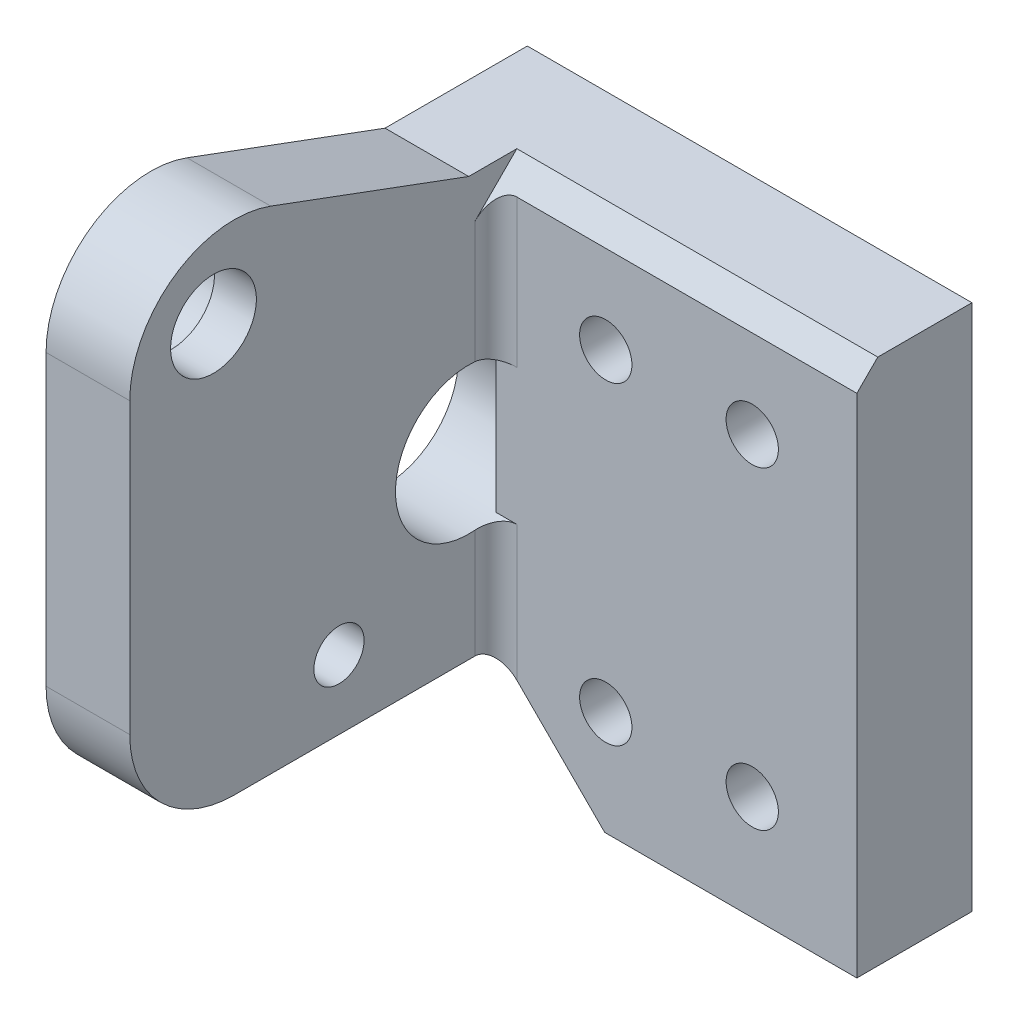
from build123d import *

# Parameters (mm, degrees)
SKETCH_1_W             = 69.5
SKETCH_1_H             = 24
EXTRUDE_1_DEPTH        = 10.5
SKETCH_2_W             = 35
SKETCH_2_H             = 3
CUT_EXTRUDE_2_DEPTH    = 24
HOLE_WIZARD_M3_1_D     = 2.5
HOLE_WIZARD_M3_1_DEPTH = 7.5
HOLE_WIZARD_M3_1_TIP   = 0.751075774
CHAMFER_1_SIZE         = 0.5
CHAMFER_2_SIZE         = 0.5
CHAMFER_3_SIZE         = 5.2
FILLET1_R              = 2
SKETCH_8_W             = 10.5
SKETCH_8_H             = 1.2
EXTRUDE_1_2_DEPTH      = 69.5
SKETCH_7_W             = 35
SKETCH_7_H             = 30
CUT_EXTRUDE_1_DEPTH    = 71.5
FILLET_1_R             = 2
FILLET_2_R             = 2
SKETCH2_W              = 16.266114445
SKETCH2_H              = 35.800653755
SKETCH2_W_2            = 16.722173729
SKETCH2_H_2            = 38.308979815
EXTRUDE1_DEPTH         = 5
SKETCH4_R              = 2.05
SKETCH4_R_2            = 3.5
EXTRUDE2_DEPTH         = 4
FILLET2_R              = 5
SKETCH7_R              = 3.5
SKETCH7_R_2            = 2.05
EXTRUDE3_DEPTH         = 4
FILLET3_R              = 5
FILLET5_R              = 1
SKETCH14_R             = 2.4
EXTRUDE4_DEPTH         = 2
SKETCH15_R             = 2.4
EXTRUDE5_DEPTH         = 2
SKETCH_9_W             = 36.650882696
SKETCH_9_H             = 47.613245362
CUT_EXTRUDE_2_2_DEPTH  = 49.168282868
SKETCH_10_W            = 16.727542875
SKETCH_10_H            = 39.365484233
CUT_EXTRUDE_3_DEPTH    = 5
CHAMFER_8_SIZE         = 1
FILLET_4_R             = 1


with BuildPart() as part:
    # 草图1 → Extrude 1 (new body)
    with BuildSketch(Plane.XY):
        Rectangle(SKETCH_1_W, SKETCH_1_H)
    extrude(amount=EXTRUDE_1_DEPTH)

    # 草图2 → Cut-Extrude 2 (cut)
    with BuildSketch(Plane.XZ.offset(12)):
        with Locations((0, 1.5)):
            Rectangle(SKETCH_2_W, SKETCH_2_H)
    extrude(amount=-CUT_EXTRUDE_2_DEPTH, mode=Mode.SUBTRACT)

    # M3 螺纹孔1
    with Locations(Plane(origin=(22.5, 8, 0), x_dir=(-1, 0, 0), z_dir=(0, 0, -1))):
        with Locations((0, 0), (0, -15), (45, -15), (45, 0), (-7, 0), (-7, -15), (52, -15), (52, 0)):
            Hole(HOLE_WIZARD_M3_1_D / 2, depth=HOLE_WIZARD_M3_1_DEPTH)
            with Locations((0, 0, -(HOLE_WIZARD_M3_1_DEPTH + HOLE_WIZARD_M3_1_TIP / 2))):  # 118° drill point
                Cone(0, HOLE_WIZARD_M3_1_D / 2, HOLE_WIZARD_M3_1_TIP, mode=Mode.SUBTRACT)

    # 倒角1
    chamfer_1_edges = [part.edges().sort_by_distance(p)[0] for p in [
        (-23.75, 8, 0),
        (-23.75, -7, 0),
        (21.25, -7, 0),
        (21.25, 8, 0),
    ]]
    chamfer(chamfer_1_edges, length=CHAMFER_1_SIZE)

    # 倒角2
    chamfer_2_edges = [part.edges().sort_by_distance(p)[0] for p in [
        (-30.75, 8, 0),
        (-30.75, -7, 0),
        (28.25, -7, 0),
        (28.25, 8, 0),
    ]]
    chamfer(chamfer_2_edges, length=CHAMFER_2_SIZE)

    # 倒角3
    chamfer_3_edges = [part.edges().sort_by_distance(p)[0] for p in [
        (34.75, -12, 5.25),
        (-34.75, -12, 5.25),
    ]]
    chamfer(chamfer_3_edges, length=CHAMFER_3_SIZE)

    # Fillet1
    fillet1_edges = [part.edges().sort_by_distance(p)[0] for p in [
        (0, -12, 10.5),
    ]]
    fillet(fillet1_edges, radius=FILLET1_R)

    # 草图8 → Extrude 1 2 (add)
    with BuildSketch(Plane(origin=(34.75, 0, 0), x_dir=(0, 0, -1), z_dir=(1, 0, 0))):
        with Locations((-5.25, 12.6)):
            Rectangle(SKETCH_8_W, SKETCH_8_H)
    extrude(amount=-EXTRUDE_1_2_DEPTH)

    # 草图7 → 切除-拉伸1 (cut)
    with BuildSketch(Plane.XY.offset(10.5)):
        with Locations((0, 3)):
            Rectangle(SKETCH_7_W, SKETCH_7_H)
    extrude(amount=-CUT_EXTRUDE_1_DEPTH, mode=Mode.SUBTRACT)


with BuildPart() as cut_extrude_1_piece_1:
    # of the separate pieces the step leaves, piece 1, a body of its own (cut_extrude_1_pieces)
    add(part.part.solids().sort_by_distance((29.55, -12, 8.5))[0])

    # 圆角1
    fillet_1_edges = [cut_extrude_1_piece_1.edges().sort_by_distance(p)[0] for p in [
        (26.125, 13.2, 10.5),
    ]]
    fillet(fillet_1_edges, radius=FILLET_1_R)


with BuildPart() as cut_extrude_1_piece_2:
    # of the separate pieces the step leaves, piece 2, a body of its own (cut_extrude_1_pieces)
    add(part.part.solids().sort_by_distance((-29.55, -12, 8.5))[0])

    # 圆角2
    fillet_2_edges = [cut_extrude_1_piece_2.edges().sort_by_distance(p)[0] for p in [
        (-26.125, 13.2, 10.5),
    ]]
    fillet(fillet_2_edges, radius=FILLET_2_R)


with BuildPart() as extrude1_tool:
    # Sketch2 → Extrude1 (new body)
    with BuildSketch(Plane.XY.offset(10.5)):
        with Locations((34.133057222, -0.236108687)):
            Rectangle(SKETCH2_W, SKETCH2_H)
        with Locations((-34.361086865, 1.85416303)):
            Rectangle(SKETCH2_W_2, SKETCH2_H_2)
    extrude(amount=-EXTRUDE1_DEPTH)


with BuildPart() as cut_extrude_1_piece_1_1:
    add(cut_extrude_1_piece_1.part)

    # Extrude1: cut by extrude1_tool
    add(extrude1_tool.part, mode=Mode.SUBTRACT)

    # Sketch7 → Extrude3 (add)
    with BuildSketch(Plane(origin=(34.75, 0, 0), x_dir=(0, 0, -1), z_dir=(1, 0, 0))):
        Polygon((0, -6.797975685), (0, 13.202024315), (-6.8, 13.202024315), (-23, 19.202024315), (-23, -6.797975685), align=None)
        with Locations(Location((-6.8, 1.9, 0), (0, 0, 68.196252011))):
            Circle(SKETCH7_R, mode=Mode.SUBTRACT)
        with Locations(Location((-19, 13.2, 0), (0, 0, 180))):
            Circle(SKETCH7_R_2, mode=Mode.SUBTRACT)
    extrude(amount=EXTRUDE3_DEPTH)

    # Fillet3
    fillet3_edges = [cut_extrude_1_piece_1_1.edges().sort_by_distance(p)[0] for p in [
        (36.75, -6.797975685, 23),
        (36.75, 19.202024315, 23),
    ]]
    fillet(fillet3_edges, radius=FILLET3_R)

    # Sketch12 → CSK for M2 Slotted raised CTSK head wood (revolve, cut)
    with BuildSketch(Plane(origin=(38.75, -3.5, 13), x_dir=(0, 0, -1), z_dir=(0, 1, 0))):
        Polygon((0, 0), (0, 77.5), (1.2, 77.5), (1.2, 1.05), (2.25, 0), align=None)
    revolve(axis=Axis((45.1, -3.5, 13), (-1, 0, 0)), mode=Mode.SUBTRACT)

    # Fillet5
    # the kernel refuses this fillet: 1 mm, written as the material it adds along each edge
    with BuildSketch(Plane(origin=(26, -12, 5.5), x_dir=(1, 0, 0), z_dir=(0, 1, 0))) as fillet5_piece_1:
        with BuildLine():
            CenterArc((FILLET5_R, -FILLET5_R), FILLET5_R, 90, 90)
            Line((0, -FILLET5_R), (0, 0))
            Line((0, 0), (FILLET5_R, 0))
        make_face()
    extrude(amount=25.2)
    with BuildSketch(Plane(origin=(34.75, -6.797975685, 5.5), x_dir=(0, 0, 1), z_dir=(0, 1, 0))) as fillet5_piece_2_section:
        with BuildLine():
            CenterArc((FILLET5_R, -FILLET5_R), FILLET5_R, 90, 90)
            Line((0, -FILLET5_R), (0, 0))
            Line((0, 0), (FILLET5_R, 0))
        make_face()
    fillet5_piece_2 = extrude(amount=7.948360323, mode=Mode.PRIVATE)
    fillet5_piece_2 = fillet5_piece_2 - Plane(origin=(34.525455487, 1.9, 6.8), x_dir=(0, 0.9284615319608756, -0.371428571422372), z_dir=(-1, 0, 0)) * Cylinder(3.5, 20, mode=Mode.PRIVATE)
    add(fillet5_piece_2)
    with BuildSketch(Plane(origin=(34.75, 2.649615362, 5.5), x_dir=(0, 0, 1), z_dir=(0, 1, 0))) as fillet5_piece_3_section:
        with BuildLine():
            CenterArc((FILLET5_R, -FILLET5_R), FILLET5_R, 90, 90)
            Line((0, -FILLET5_R), (0, 0))
            Line((0, 0), (FILLET5_R, 0))
        make_face()
    fillet5_piece_3 = extrude(amount=10.550384638, mode=Mode.PRIVATE)
    fillet5_piece_3 = fillet5_piece_3 - Plane(origin=(34.525839379, 1.9, 6.8), x_dir=(0, 0.9284615319608756, -0.371428571422372), z_dir=(-1, 0, 0)) * Cylinder(3.5, 26, mode=Mode.PRIVATE)
    add(fillet5_piece_3)

    # Sketch15 → Extrude5 (cut)
    with BuildSketch(Plane(origin=(38.75, 0, 0), x_dir=(0, 0, -1), z_dir=(1, 0, 0))):
        with Locations(Location((-19, 13.2, 0), (0, 0, 180))):
            Circle(SKETCH15_R)
    extrude(amount=-EXTRUDE5_DEPTH, mode=Mode.SUBTRACT)

    # 草图9 → Cut-Extrude 2 2 (cut, through all)
    with BuildSketch(Plane.XY.offset(23)):
        with Locations((21.816576683, -0.846593787)):
            Rectangle(SKETCH_9_W, SKETCH_9_H)
    extrude(amount=-CUT_EXTRUDE_2_2_DEPTH, mode=Mode.SUBTRACT)


with BuildPart() as cut_extrude_1_piece_2_1:
    add(cut_extrude_1_piece_2.part)

    # Extrude1: cut by extrude1_tool
    add(extrude1_tool.part, mode=Mode.SUBTRACT)

    # Sketch4 → Extrude2 (add)
    with BuildSketch(Plane.ZY.offset(34.75)):
        Polygon((0, -6.8), (0, 13.2), (6.8, 13.2), (23, 19.2), (23, -6.8), align=None)
        with Locations((19, 13.2)):
            Circle(SKETCH4_R, mode=Mode.SUBTRACT)
        with Locations(Location((6.8, 1.9, 0), (0, 0, 111.803747989))):
            Circle(SKETCH4_R_2, mode=Mode.SUBTRACT)
    extrude(amount=EXTRUDE2_DEPTH)

    # Fillet2
    fillet2_edges = [cut_extrude_1_piece_2_1.edges().sort_by_distance(p)[0] for p in [
        (-36.75, -6.8, 23),
        (-36.75, 19.2, 23),
    ]]
    fillet(fillet2_edges, radius=FILLET2_R)

    # Sketch13 → CSK for M2 Slotted raised CTSK head  2 (revolve, cut)
    with BuildSketch(Plane(origin=(-38.75, -3.5, 13), x_dir=(0, 0, 1), z_dir=(0, 1, 0))):
        Polygon((0, 0), (0, 4), (1.2, 4), (1.2, 1.05), (2.25, 0), align=None)
    revolve(axis=Axis((-45.1, -3.5, 13), (1, 0, 0)), mode=Mode.SUBTRACT)

    # Sketch14 → Extrude4 (cut)
    with BuildSketch(Plane.ZY.offset(38.75)):
        with Locations((19, 13.2)):
            Circle(SKETCH14_R)
    extrude(amount=-EXTRUDE4_DEPTH, mode=Mode.SUBTRACT)

    # 草图10 → 切除-拉伸3 (cut)
    with BuildSketch(Plane.XY.offset(10.5)):
        with Locations((-20.237373351, 1.950530044)):
            Rectangle(SKETCH_10_W, SKETCH_10_H)
    extrude(amount=-CUT_EXTRUDE_3_DEPTH, mode=Mode.SUBTRACT)

    # 倒角8
    chamfer_8_edges = [cut_extrude_1_piece_2_1.edges().sort_by_distance(p)[0] for p in [
        (-26.125, 13.2, 5.5),
    ]]
    chamfer(chamfer_8_edges, length=CHAMFER_8_SIZE)

    # 圆角4
    # the kernel refuses this fillet: 1 mm, written as the material it adds along each edge
    with BuildSketch(Plane(origin=(-34.75, 14.7, 5.5), x_dir=(0, 0, 1), z_dir=(0, -1, 0))) as fillet_4_piece_1_section:
        with BuildLine():
            CenterArc((FILLET_4_R, -FILLET_4_R), FILLET_4_R, 90, 90)
            Line((0, -FILLET_4_R), (0, 0))
            Line((0, 0), (FILLET_4_R, 0))
        make_face()
    fillet_4_piece_1 = extrude(amount=12.050384638, mode=Mode.PRIVATE)
    fillet_4_piece_1 = fillet_4_piece_1 - Plane(origin=(-34.522632455, 1.9, 6.8), x_dir=(0, 0.9284615319608756, -0.3714285714223719), z_dir=(1, 0, 0)) * Cylinder(3.5, 29, mode=Mode.PRIVATE)
    fillet_4_piece_1 = split(fillet_4_piece_1, bisect_by=Plane(origin=(-34.522632455, 10.293168588, 7.406831412), z_dir=(0, -0.7071067811865476, -0.7071067811865476)), keep=Keep.TOP, mode=Mode.PRIVATE)
    add(fillet_4_piece_1)
    with BuildSketch(Plane(origin=(-34.75, 1.150384638, 5.5), x_dir=(0, 0, 1), z_dir=(0, -1, 0))) as fillet_4_piece_2_section:
        with BuildLine():
            CenterArc((FILLET_4_R, -FILLET_4_R), FILLET_4_R, 90, 90)
            Line((0, -FILLET_4_R), (0, 0))
            Line((0, 0), (FILLET_4_R, 0))
        make_face()
    fillet_4_piece_2 = extrude(amount=10.450384638, mode=Mode.PRIVATE)
    fillet_4_piece_2 = split(fillet_4_piece_2, bisect_by=Plane(origin=(-35.981733075, -5.568266925, 5.72144918), z_dir=(0.7071067811865476, 0.7071067811865475, 0)), keep=Keep.TOP, mode=Mode.PRIVATE)
    fillet_4_piece_2 = fillet_4_piece_2 - Plane(origin=(-34.525455927, 1.9, 6.8), x_dir=(0, 0.9284615319608756, -0.3714285714223719), z_dir=(1, 0, 0)) * Cylinder(3.5, 25, mode=Mode.PRIVATE)
    add(fillet_4_piece_2)


solid = cut_extrude_1_piece_2_1.part
